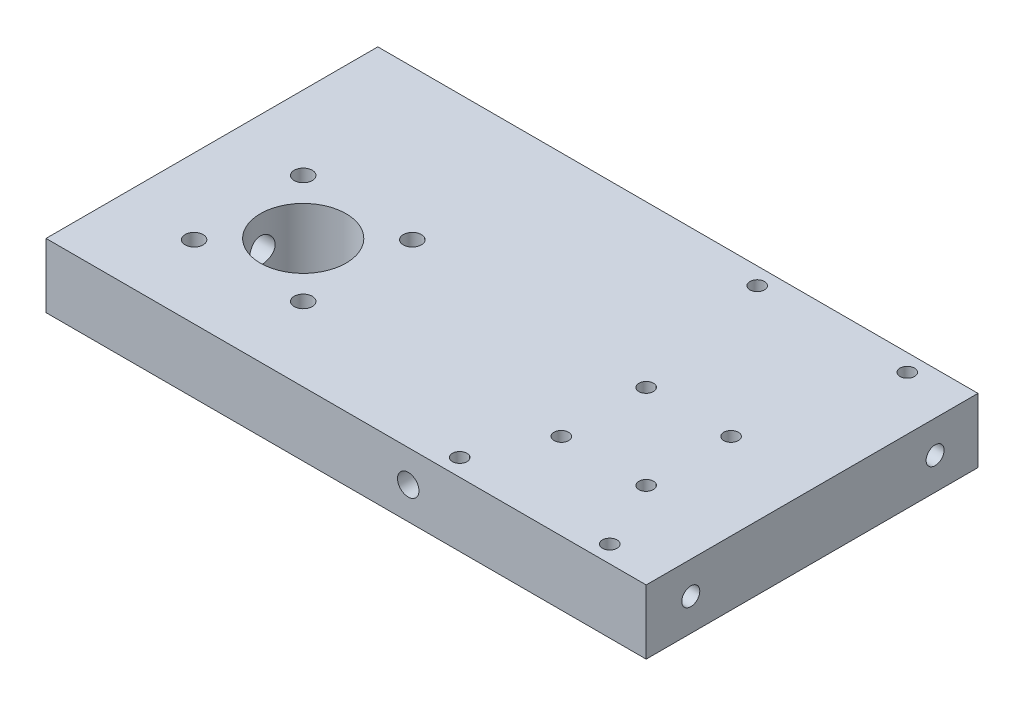
from build123d import *

# Parameters (mm, degrees)
SKETCH_1_W                 = 140
SKETCH_1_H                 = 77.4
EXTRUDE_1_DEPTH            = 15
SKETCH_6_R                 = 10.5
CUT_EXTRUDE_4_DEPTH        = 161.315345491
M5X0_8_1_D                 = 4.2
M5X0_8_1_DEPTH             = 16
M5X0_8_1_TIP               = 1.2618073
SKETCH_9_R                 = 10
CUT_EXTRUDE_6_DEPTH        = 161.67283529
M5X0_8_2_D                 = 4.2
HOLE_WIZARD_M3_1_D         = 3.4
M6X1_0_START               = -77.4
M6X1_0_3_OUTLINE_R         = 2.5
M6X1_0_3_DEPTH             = 77.4
HOLE_WIZARD_M3_2_OUTLINE_R = 1.7
HOLE_WIZARD_M3_2_DEPTH     = 15
M7X1_0_4_OUTLINE_W         = 3
M7X1_0_4_OUTLINE_H         = 20.46087378
CUT_EXTRUDE_7_REACH        = 137.336
SKETCH_27_R                = 3


# Read off the part's stored shape, not the designer's step: M6x1.0 ねじ穴3, M3 すきま穴2, M7x1.0 ねじ穴4
with BuildPart() as part:
    # ｽｹｯﾁ1 → ﾎﾞｽ - 押し出し1 (new body)
    with BuildSketch(Plane(origin=(0, 0, 0), x_dir=(1, 0, 0), z_dir=(0, 1, 0))):
        with Locations((70, 38.7)):
            Rectangle(SKETCH_1_W, SKETCH_1_H)
    extrude(amount=EXTRUDE_1_DEPTH)

    # ｽｹｯﾁ6 → ｶｯﾄ - 押し出し4 (cut, through all)
    with BuildSketch(Plane(origin=(0, 10.5, 0), x_dir=(1, 0, 0), z_dir=(0, 1, 0))):
        with Locations(Location((110, 30, 0), (0, 0, 270))):
            Circle(SKETCH_6_R)
    extrude(amount=-CUT_EXTRUDE_4_DEPTH, mode=Mode.SUBTRACT)

    # M5x0.8 ねじ穴1
    with Locations(Plane(origin=(140, 0, 0), x_dir=(0, 0, -1), z_dir=(1, 0, 0))):
        with Locations((10.4, 7.5), (67.4, 7.5)):
            Hole(M5X0_8_1_D / 2, depth=M5X0_8_1_DEPTH)
            with Locations((0, 0, -(M5X0_8_1_DEPTH + M5X0_8_1_TIP / 2))):  # 118° drill point
                Cone(0, M5X0_8_1_D / 2, M5X0_8_1_TIP, mode=Mode.SUBTRACT)

    # ｽｹｯﾁ9 → ｶｯﾄ - 押し出し6 (cut, through all)
    with BuildSketch(Plane(origin=(0, 15, 0), x_dir=(1, 0, 0), z_dir=(0, 1, 0))):
        with Locations(Location((30, 30, 0), (0, 0, 270))):
            Circle(SKETCH_9_R)
    extrude(amount=-CUT_EXTRUDE_6_DEPTH, mode=Mode.SUBTRACT)

    # M5x0.8 ねじ穴2 (through all)
    with Locations(Plane(origin=(0, 15, 0), x_dir=(1, 0, 0), z_dir=(0, 1, 0))):
        with Locations((42.991460674, 42.458810119), (17.272077939, 42.727922061), (42.727922061, 17.272077939), (17.541189881, 17.008539326)):
            Hole(M5X0_8_2_D / 2)

    # M3 すきま穴1 (through all)
    with Locations(Plane(origin=(0, 15, 0), x_dir=(1, 0, 0), z_dir=(0, 1, 0))):
        with Locations((119.899494937, 39.899494937), (119.899494937, 20.100505063), (100.100505063, 20.100505063), (100.100505063, 39.899494937)):
            Hole(HOLE_WIZARD_M3_1_D / 2)

    # M6x1.0 ねじ穴3 outline → M6x1.0 ねじ穴3 (cut)
    with BuildSketch(Plane.XY.offset(M6X1_0_START)):
        with Locations((84.5, 7.5)):
            Circle(M6X1_0_3_OUTLINE_R)
    extrude(amount=M6X1_0_3_DEPTH, mode=Mode.SUBTRACT)

    # M3 すきま穴2 outline → M3 すきま穴2 (cut)
    with BuildSketch(Plane(origin=(0, 0, 0), x_dir=(1, 0, 0), z_dir=(0, 1, 0))):
        with Locations((92.5, 73.4)):
            Circle(HOLE_WIZARD_M3_2_OUTLINE_R)
        with Locations((127.5, 73.4)):
            Circle(HOLE_WIZARD_M3_2_OUTLINE_R)
        with Locations((92.5, 4)):
            Circle(HOLE_WIZARD_M3_2_OUTLINE_R)
        with Locations((127.5, 4)):
            Circle(HOLE_WIZARD_M3_2_OUTLINE_R)
    extrude(amount=HOLE_WIZARD_M3_2_DEPTH, mode=Mode.SUBTRACT)

    # M7x1.0 ねじ穴4 outline → M7x1.0 ねじ穴4 (revolve, cut)
    with BuildSketch(Plane(origin=(0, 7.5, -30), x_dir=(0, 1, 0), z_dir=(0, 0, -1))):
        with Locations((1.5, 10.23043689)):
            Rectangle(M7X1_0_4_OUTLINE_W, M7X1_0_4_OUTLINE_H)
    revolve(axis=Axis((0, 7.5, -30), (1, 0, 0)), mode=Mode.SUBTRACT)

    # ｽｹｯﾁ27 → ｶｯﾄ - 押し出し7 (cut, up to next)
    with BuildSketch(Plane.ZY.offset(-30), mode=Mode.PRIVATE) as cut_extrude_7_sk1:
        with Locations((-30, 7.5)):
            Circle(SKETCH_27_R)
    cut_extrude_7_tool1 = extrude(cut_extrude_7_sk1.sketch, amount=-CUT_EXTRUDE_7_REACH, mode=Mode.PRIVATE) & part.part
    add(cut_extrude_7_tool1.solids().sort_by_distance((30, 7.5, -30))[0], mode=Mode.SUBTRACT)


solid = part.part
